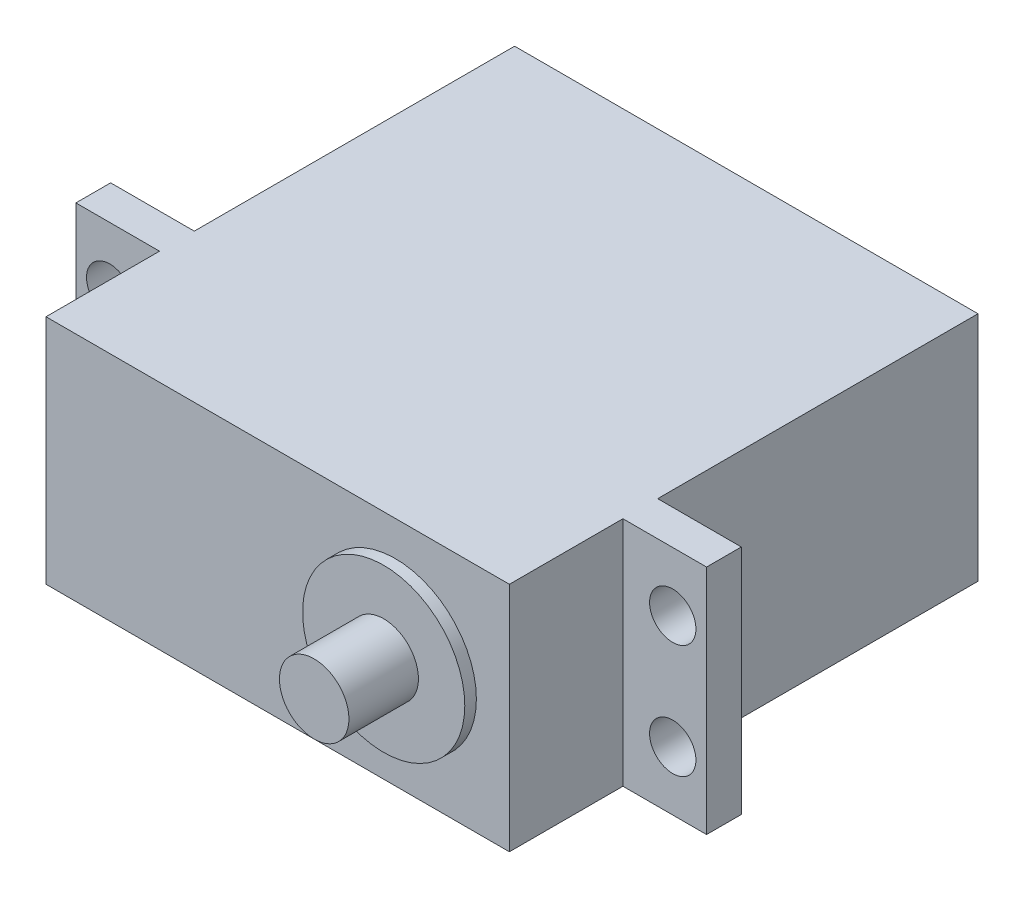
from build123d import *

# Parameters (mm, degrees)
SKETCH2_W           = 40
SKETCH2_H           = 20
BOSS_EXTRUDE1_DEPTH = 27.65
SKETCH3_W           = 54.44
SKETCH3_H           = 20
SKETCH3_R           = 2
BOSS_EXTRUDE2_DEPTH = 3
SKETCH4_W           = 40
SKETCH4_H           = 20
BOSS_EXTRUDE3_DEPTH = 9.8
SKETCH5_R           = 7
BOSS_EXTRUDE4_DEPTH = 1
SKETCH6_R           = 3
BOSS_EXTRUDE5_DEPTH = 6


with BuildPart() as part:
    # Sketch2 → Boss-Extrude1 (new body)
    with BuildSketch(Plane.XY):
        with Locations((-33.592215537, 218.387921433)):
            Rectangle(SKETCH2_W, SKETCH2_H)
    extrude(amount=BOSS_EXTRUDE1_DEPTH)

    # Sketch3 → Boss-Extrude2 (add)
    with BuildSketch(Plane.XY.offset(27.65)):
        with Locations((-33.592215537, 218.387921433)):
            Rectangle(SKETCH3_W, SKETCH3_H)
        with Locations((-9.292215537, 213.487921433)):
            Circle(SKETCH3_R, mode=Mode.SUBTRACT)
        with Locations((-9.292215537, 223.287921433)):
            Circle(SKETCH3_R, mode=Mode.SUBTRACT)
        with Locations((-57.892215537, 223.287921433)):
            Circle(SKETCH3_R, mode=Mode.SUBTRACT)
        with Locations((-57.892215537, 213.487921433)):
            Circle(SKETCH3_R, mode=Mode.SUBTRACT)
    extrude(amount=BOSS_EXTRUDE2_DEPTH)

    # Sketch4 → Boss-Extrude3 (add)
    with BuildSketch(Plane.XY.offset(30.65)):
        with Locations((-33.592215537, 218.387921433)):
            Rectangle(SKETCH4_W, SKETCH4_H)
    extrude(amount=BOSS_EXTRUDE3_DEPTH)

    # Sketch5 → Boss-Extrude4 (add)
    with BuildSketch(Plane.XY.offset(40.45)):
        with Locations((-23.442215537, 218.387921433)):
            Circle(SKETCH5_R)
    extrude(amount=BOSS_EXTRUDE4_DEPTH)

    # Sketch6 → Boss-Extrude5 (add)
    with BuildSketch(Plane.XY.offset(41.45)):
        with Locations((-23.442215537, 218.387921433)):
            Circle(SKETCH6_R)
    extrude(amount=BOSS_EXTRUDE5_DEPTH)


solid = part.part
